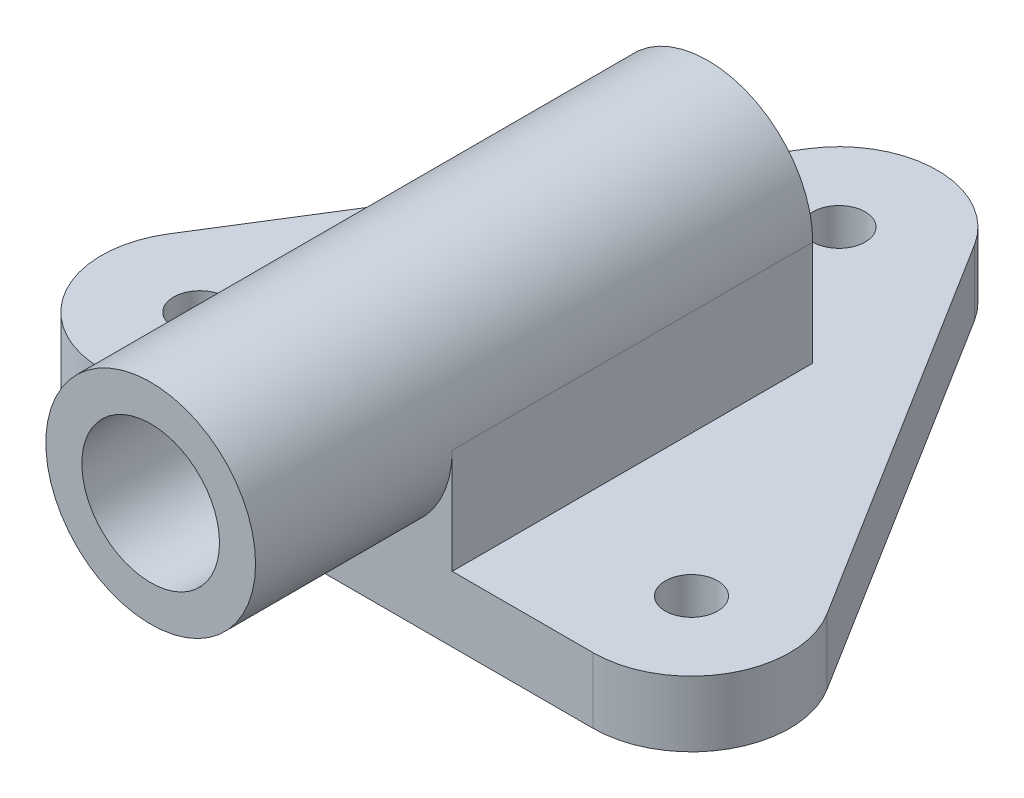
from build123d import *
from build123d.topology import SkipClean

# Parameters (mm, degrees)
SKETCH1_R           = 4
BOSS_EXTRUDE1_DEPTH = 10
SKETCH2_R           = 16
SKETCH2_R_2         = 10.5
BOSS_EXTRUDE2_DEPTH = 30
SKETCH2_3_R         = 16
SKETCH2_3_R_2       = 10.5
BOSS_EXTRUDE3_DEPTH = 55
BOSS_EXTRUDE4_DEPTH = 55


with BuildPart() as part:
    # Sketch1 → Boss-Extrude1 (new body)
    with BuildSketch(Plane(origin=(0, 0, 0), x_dir=(1, 0, 0), z_dir=(0, 1, 0))):
        with BuildLine():
            Line((-12.71997456, 7.9499841), (-50.21997456, -52.0500159))
            ThreePointArc((-50.21997456, -52.0500159), (-50.619637219, -67.271527986), (-37.5, -75))
            Line((-37.5, -75), (37.5, -75))
            ThreePointArc((37.5, -75), (50.619637219, -67.271527986), (50.21997456, -52.0500159))
            Line((50.21997456, -52.0500159), (12.71997456, 7.9499841))
            ThreePointArc((12.71997456, 7.9499841), (0, 15), (-12.71997456, 7.9499841))
        make_face()
        with Locations(Location((0, 0, 0), (0, 0, 270))):
            Circle(SKETCH1_R, mode=Mode.SUBTRACT)
        with Locations(Location((-37.5, -60, 0), (0, 0, 270))):
            Circle(SKETCH1_R, mode=Mode.SUBTRACT)
        with Locations(Location((37.5, -60, 0), (0, 0, 270))):
            Circle(SKETCH1_R, mode=Mode.SUBTRACT)
    extrude(amount=BOSS_EXTRUDE1_DEPTH)



with BuildPart() as body_2:
    # Sketch2 → Boss-Extrude2 (new body)
    with BuildSketch(Plane.XY.offset(75)):
        with Locations((0, 26)):
            Circle(SKETCH2_R)
        with Locations((0, 26)):
            Circle(SKETCH2_R_2, mode=Mode.SUBTRACT)
    extrude(amount=BOSS_EXTRUDE2_DEPTH)

    # Sketch2<3> → Boss-Extrude3 (add)
    with SkipClean():  # the faces are left unmerged after this step: merging them gives an invalid solid
        with BuildSketch(Plane.XY.offset(75)):
            with Locations((0, 26)):
                Circle(SKETCH2_3_R)
            with Locations((0, 26)):
                Circle(SKETCH2_3_R_2, mode=Mode.SUBTRACT)
        extrude(amount=-BOSS_EXTRUDE3_DEPTH)


with BuildPart() as part_1:
    add(part.part)

    add(body_2.part)  # Boss-Extrude4 merges body 2
    # Sketch2<4> → Boss-Extrude4 (add)
    with BuildSketch(Plane.XY.offset(75)):
        with BuildLine():
            Line((16, 10), (16, 26))
            ThreePointArc((16, 26), (11.313708518, 14.68629152), (5.5e-08, 10))
            Line((5.5e-08, 10), (16, 10))
        make_face()
        with BuildLine():
            ThreePointArc((5.5e-08, 10), (-11.31370848, 14.686291482), (-16, 26))
            Line((-16, 26), (-16, 10))
            Line((-16, 10), (5.5e-08, 10))
        make_face()
    extrude(amount=-BOSS_EXTRUDE4_DEPTH)


solid = part_1.part
